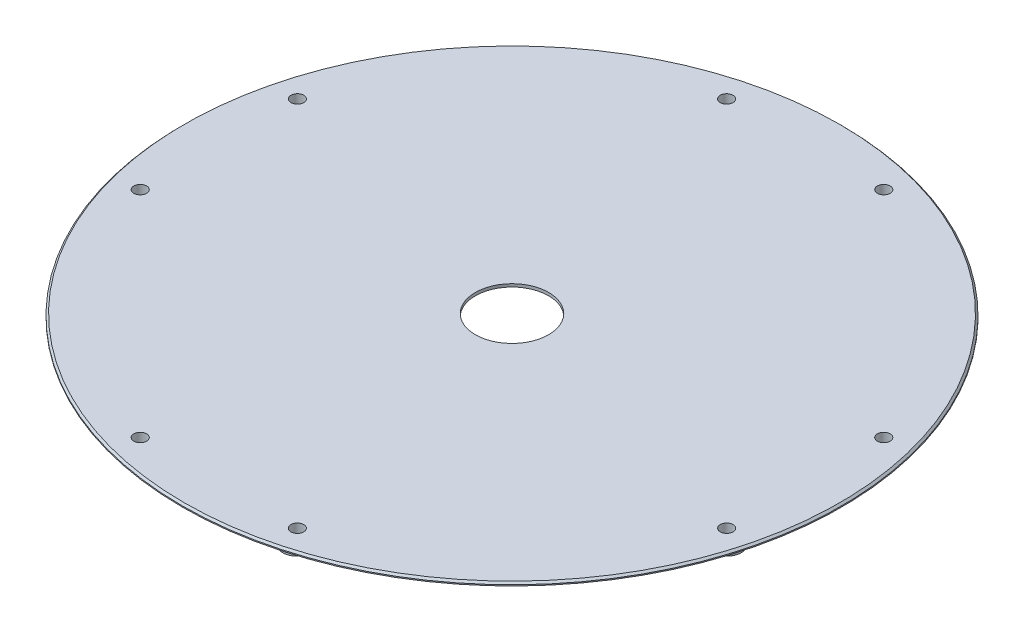
from build123d import *

# Parameters (mm, degrees)
SKIZZE1_R                       = 90
AUFSATZ_LINEAR_AUSTRAGEN1_DEPTH = 0.8
SKIZZE2_W                       = 6
SKIZZE2_H                       = 10
AUFSATZ_LINEAR_AUSTRAGEN2_DEPTH = 14
FASE1_SIZE                      = 14
SKIZZE3_R                       = 2.15
SCHNITT_LINEAR_AUSTRAGEN1_DEPTH = 42
KREISMUSTER1_COUNT              = 3
FASE1_OF_KREISMUSTER1_SIZE      = 14
AUFSATZ_LINEAR_AUSTRAGEN3_DEPTH = 3
AUFSATZ_LINEAR_AUSTRAGEN4_DEPTH = 3
SCHNITT_LINEAR_AUSTRAGEN2_REACH = 129.754
SKIZZE7_R                       = 1.75
KREISMUSTER2_COUNT              = 4
SCHNITT_LINEAR_AUSTRAGEN3_REACH = 130.137
SKIZZE8_R                       = 10
FASE2_SIZE                      = 0.5


with BuildPart() as part:
    # Skizze1 → Aufsatz-Linear austragen1 (new body)
    with BuildSketch(Plane(origin=(0, 0, 0), x_dir=(1, 0, 0), z_dir=(0, 1, 0))):
        with Locations(Location((0, 0, 0), (0, 0, 270))):
            Circle(SKIZZE1_R)
    extrude(amount=AUFSATZ_LINEAR_AUSTRAGEN1_DEPTH)

    # Skizze2 → Aufsatz-Linear austragen2 (add)
    with BuildSketch(Plane.XZ):
        with Locations((-18, 35)):
            Rectangle(SKIZZE2_W, SKIZZE2_H)
        with Locations((18, 35)):
            Rectangle(SKIZZE2_W, SKIZZE2_H)
    aufsatz_linear_austragen2 = extrude(amount=AUFSATZ_LINEAR_AUSTRAGEN2_DEPTH)

    # Fase1
    fase1_edges = [part.edges().sort_by_distance(p)[0] for p in [
        (18, 0, 40),
        (-18, 0, 40),
    ]]
    chamfer(fase1_edges, length=FASE1_SIZE - 0.0001)  # a hair under: the kernel refuses the full size

    # Skizze3 → Schnitt-Linear austragen1 (cut)
    with BuildSketch(Plane(origin=(21, 0, 0), x_dir=(0, 0, -1), z_dir=(1, 0, 0))):
        with Locations((-35, -7)):
            Circle(SKIZZE3_R)
    schnitt_linear_austragen1 = extrude(amount=-SCHNITT_LINEAR_AUSTRAGEN1_DEPTH, mode=Mode.SUBTRACT)

    # Kreismuster1: Aufsatz-Linear austragen2, Schnitt-Linear austragen1 ×3 about axis
    kreismuster1_axis = Axis((0, 0, 0), (0, 1, 0))
    add([aufsatz_linear_austragen2.rotate(kreismuster1_axis, i * 360 / KREISMUSTER1_COUNT) for i in range(1, KREISMUSTER1_COUNT)])
    add([schnitt_linear_austragen1.rotate(kreismuster1_axis, i * 360 / KREISMUSTER1_COUNT) for i in range(1, KREISMUSTER1_COUNT)], mode=Mode.SUBTRACT)

    # Fase1 of Kreismuster1
    fase1_of_kreismuster1_edges = [part.edges().sort_by_distance(p)[0] for p in [
        (25.641016151, 0, -35.588457268),
        (43.641016151, 0, -4.411542732),
        (-43.641016151, 0, -4.411542732),
        (-25.641016151, 0, -35.588457268),
    ]]
    chamfer(fase1_of_kreismuster1_edges, length=FASE1_OF_KREISMUSTER1_SIZE - 0.0001)  # a hair under: the kernel refuses the full size

    # Skizze4 → Aufsatz-Linear austragen3 (add)
    with BuildSketch(Plane.XZ):
        with BuildLine():
            ThreePointArc((-70.255477849, -23.241510972), (-64.08587988, 37), (-15, 72.463784058))
            Line((-15, 72.463784058), (-15, 78.581168228))
            ThreePointArc((-15, 78.581168228), (-69.282032303, 40), (-75.553287944, -26.300203057))
            Line((-75.553287944, -26.300203057), (-70.255477849, -23.241510972))
        make_face()
        with BuildLine():
            Line((15, 78.581168228), (15, 72.463784058))
            ThreePointArc((15, 72.463784058), (57.384666942, 46.722585545), (74, 0))
            ThreePointArc((74, 0), (73.057872132, -11.770612542), (70.255477849, -23.241510972))
            Line((70.255477849, -23.241510972), (75.553287944, -26.300203057))
            ThreePointArc((75.553287944, -26.300203057), (78.880488828, -13.336734317), (80, 0))
            ThreePointArc((80, 0), (61.64414003, 50.990195136), (15, 78.581168228))
        make_face()
        with BuildLine():
            ThreePointArc((55.255477849, -49.222273086), (0, -74), (-55.255477849, -49.222273086))
            Line((-55.255477849, -49.222273086), (-60.553287944, -52.280965171))
            ThreePointArc((-60.553287944, -52.280965171), (0, -80), (60.553287944, -52.280965171))
            Line((60.553287944, -52.280965171), (55.255477849, -49.222273086))
        make_face()
        with BuildLine():
            Line((15.480762114, -33.186533479), (18.480762114, -27.990381057))
            ThreePointArc((18.480762114, -27.990381057), (0, -33.541019662), (-18.480762114, -27.990381057))
            Line((-18.480762114, -27.990381057), (-15.480762114, -33.186533479))
            ThreePointArc((-15.480762114, -33.186533479), (0, -36.619666847), (15.480762114, -33.186533479))
        make_face()
        with BuildLine():
            ThreePointArc((-33.480762114, -2.009618943), (-29.047375097, 16.770509831), (-15, 30))
            Line((-15, 30), (-21, 30))
            ThreePointArc((-21, 30), (-31.713561768, 18.309833424), (-36.480762114, 3.186533479))
            Line((-36.480762114, 3.186533479), (-33.480762114, -2.009618943))
        make_face()
        with BuildLine():
            ThreePointArc((15, 30), (28.531695489, 17.633557569), (33.541019662, 0))
            ThreePointArc((33.541019662, 0), (33.525951891, -1.005261069), (33.480762114, -2.009618943))
            Line((33.480762114, -2.009618943), (36.480762114, 3.186533479))
            ThreePointArc((36.480762114, 3.186533479), (31.713561768, 18.309833424), (21, 30))
            Line((21, 30), (15, 30))
        make_face()
    extrude(amount=AUFSATZ_LINEAR_AUSTRAGEN3_DEPTH)

    # Skizze6 → Aufsatz-Linear austragen4 (add)
    with BuildSketch(Plane.XZ):
        with BuildLine():
            Line((-24.543328812, -76.142136894), (-25.319785948, -79.039914373))
            ThreePointArc((-25.319785948, -79.039914373), (-22.491358823, -83.938893859), (-17.592379337, -81.110466734))
            Line((-17.592379337, -81.110466734), (-16.815922202, -78.212689255))
            Line((-16.815922202, -78.212689255), (-24.543328812, -76.142136894))
        make_face()
        with BuildLine():
            Line((24.543328812, -76.142136894), (16.815922202, -78.212689255))
            Line((16.815922202, -78.212689255), (17.592379337, -81.110466734))
            ThreePointArc((17.592379337, -81.110466734), (22.491358823, -83.938893859), (25.319785948, -79.039914373))
            Line((25.319785948, -79.039914373), (24.543328812, -76.142136894))
        make_face()
    aufsatz_linear_austragen4 = extrude(amount=AUFSATZ_LINEAR_AUSTRAGEN4_DEPTH)

    # Skizze7 → Schnitt-Linear austragen2 (cut, up to next)
    with BuildSketch(Plane.XZ.offset(3), mode=Mode.PRIVATE) as schnitt_linear_austragen2_sk1:
        with Locations(Location((-21.456082643, -80.075190553, 0), (0, 0, 270))):
            Circle(SKIZZE7_R)
    schnitt_linear_austragen2_tool1 = extrude(schnitt_linear_austragen2_sk1.sketch, amount=-SCHNITT_LINEAR_AUSTRAGEN2_REACH, mode=Mode.PRIVATE) & part.part
    # Skizze7 → Schnitt-Linear austragen2 (cut, up to next)
    with BuildSketch(Plane.XZ.offset(3), mode=Mode.PRIVATE) as schnitt_linear_austragen2_sk2:
        with Locations(Location((21.456082643, -80.075190553, 0), (0, 0, 270))):
            Circle(SKIZZE7_R)
    schnitt_linear_austragen2_tool2 = extrude(schnitt_linear_austragen2_sk2.sketch, amount=-SCHNITT_LINEAR_AUSTRAGEN2_REACH, mode=Mode.PRIVATE) & part.part
    schnitt_linear_austragen2_1 = schnitt_linear_austragen2_tool1.solids().sort_by_distance((-21.456083, -3, -80.075191))[0]
    add(schnitt_linear_austragen2_1, mode=Mode.SUBTRACT)
    schnitt_linear_austragen2_2 = schnitt_linear_austragen2_tool2.solids().sort_by_distance((21.456083, -3, -80.075191))[0]
    add(schnitt_linear_austragen2_2, mode=Mode.SUBTRACT)
    schnitt_linear_austragen2 = schnitt_linear_austragen2_1 + schnitt_linear_austragen2_2  # Schnitt-Linear austragen2 as one shape, for the pattern or mirror that repeats it

    # Kreismuster2: Aufsatz-Linear austragen4, Schnitt-Linear austragen2 ×4 about axis
    kreismuster2_axis = Axis((0, 0, 0), (0, 1, 0))
    add([aufsatz_linear_austragen4.rotate(kreismuster2_axis, i * 360 / KREISMUSTER2_COUNT) for i in range(1, KREISMUSTER2_COUNT)])
    add([schnitt_linear_austragen2.rotate(kreismuster2_axis, i * 360 / KREISMUSTER2_COUNT) for i in range(1, KREISMUSTER2_COUNT)], mode=Mode.SUBTRACT)

    # Skizze8 → Schnitt-Linear austragen3 (cut, up to next)
    with BuildSketch(Plane(origin=(0, 0.8, 0), x_dir=(1, 0, 0), z_dir=(0, 1, 0)), mode=Mode.PRIVATE) as schnitt_linear_austragen3_sk1:
        with Locations(Location((0, 0, 0), (0, 0, 270))):
            Circle(SKIZZE8_R)
    schnitt_linear_austragen3_tool1 = extrude(schnitt_linear_austragen3_sk1.sketch, amount=-SCHNITT_LINEAR_AUSTRAGEN3_REACH, mode=Mode.PRIVATE) & part.part
    add(schnitt_linear_austragen3_tool1.solids().sort_by_distance((0, 0.8, 0))[0], mode=Mode.SUBTRACT)

    # Fase2
    fase2_edges = [part.edges().sort_by_distance(p)[0] for p in [
        (0, 0.8, -90),
    ]]
    chamfer(fase2_edges, length=FASE2_SIZE)


solid = part.part
